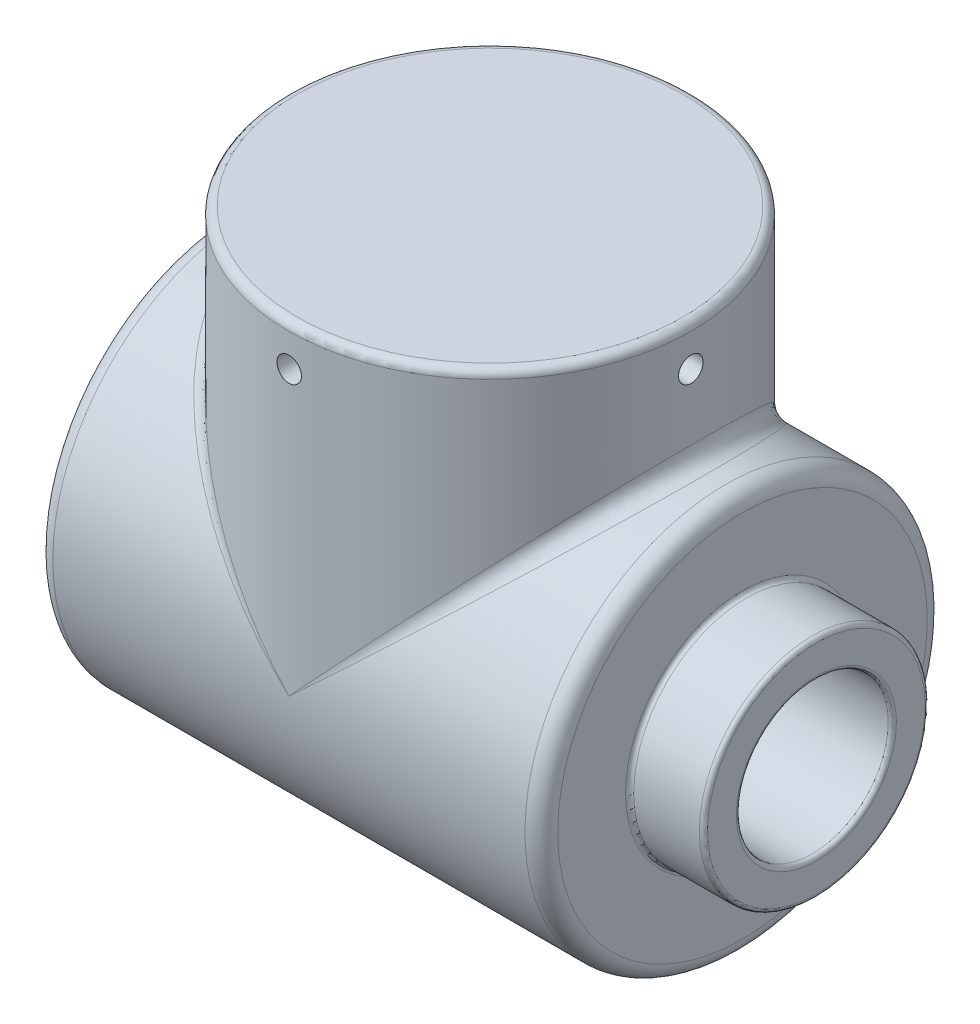
from build123d import *

# Parameters (mm, degrees)
SKETCH5_R                                  = 18.5
CUT_EXTRUDE2_DEPTH                         = 138
SKETCH11_R                                 = 49
BOSS_EXTRUDE3_DEPTH                        = 30
BOSS_EXTRUDE3_DIRECTION_2_REACH            = 137.371
BOSS_EXTRUDE3_DIRECTION_2_END_RADIUS       = 49
CUT_EXTRUDE3_REACH                         = 168.391
SKETCH12_R                                 = 2.3
CIRPATTERN1_COUNT                          = 6
SKETCH14_R                                 = 2.975
CUT_EXTRUDE4_DEPTH                         = 7.62
SKETCH15_R                                 = 2.99
CUT_EXTRUDE5_DEPTH                         = 4.7
MIRROR2_AT_THE_SECOND_PLANE_COPY_1_SKETC_R = 2.99
MIRROR2_AT_THE_SECOND_PLANE_COPY_1_DEPTH   = 4.7
FILLET3_R                                  = 2
FILLET4_R                                  = 4
FILLET5_R                                  = 4
FILLET6_R                                  = 4
FILLET7_R                                  = 1
FILLET8_R                                  = 0.5


with BuildPart() as part:
    # Sketch4 → Revolve2 (revolve)
    with BuildSketch(Plane.XY):
        Polygon((-61.5, 0), (79.5, 0), (79.5, 27.5), (61.5, 27.5), (61.5, 49), (-61.5, 49), align=None)
    revolve(axis=Axis((-61.5, 0, 0), (1, 0, 0)))

    # Sketch5 → Cut-Extrude2 (cut)
    with BuildSketch(Plane(origin=(79.5, 0, 0), x_dir=(0, 0, -1), z_dir=(1, 0, 0))):
        Circle(SKETCH5_R)
    extrude(amount=-CUT_EXTRUDE2_DEPTH, mode=Mode.SUBTRACT)

    # Sketch11 → Boss-Extrude3 (add)
    with BuildSketch(Plane(origin=(0, 49, 0), x_dir=(1, 0, 0), z_dir=(0, 1, 0))):
        Circle(SKETCH11_R)
    extrude(amount=BOSS_EXTRUDE3_DEPTH)

    # Boss-Extrude3 direction 2: up to this cylinder (the profile starts outside it)
    boss_extrude3_direction_2_end = Plane(origin=(0, 0, 0), z_dir=(-1, 0, 0)) * Cylinder(BOSS_EXTRUDE3_DIRECTION_2_END_RADIUS, 373.742, mode=Mode.PRIVATE)
    # Sketch11 → Boss-Extrude3 direction 2 (add, up to the surface)
    with BuildSketch(Plane(origin=(0, 49, 0), x_dir=(1, 0, 0), z_dir=(0, 1, 0)), mode=Mode.PRIVATE) as boss_extrude3_direction_2_sk1:
        Circle(SKETCH11_R)
    boss_extrude3_direction_2_tool1 = extrude(boss_extrude3_direction_2_sk1.sketch, amount=-BOSS_EXTRUDE3_DIRECTION_2_REACH, mode=Mode.PRIVATE) - boss_extrude3_direction_2_end
    add(boss_extrude3_direction_2_tool1.solids().sort_by_distance((0, 49, 0))[0])
    add(boss_extrude3_direction_2_tool1.solids().sort_by_distance((0, 49, 0))[1])

    # Sketch12 → Cut-Extrude3 (cut, up to next)
    with BuildSketch(Plane(origin=(-58.5, 0, 0), x_dir=(0, 0, -1), z_dir=(1, 0, 0)), mode=Mode.PRIVATE) as cut_extrude3_sk1:
        with Locations((0, 14)):
            Circle(SKETCH12_R)
    cut_extrude3_tool1 = extrude(cut_extrude3_sk1.sketch, amount=-CUT_EXTRUDE3_REACH, mode=Mode.PRIVATE) & part.part
    cut_extrude3 = cut_extrude3_tool1.solids().sort_by_distance((-58.5, 14, 0))[0]
    add(cut_extrude3, mode=Mode.SUBTRACT)

    # CirPattern1: Cut-Extrude3 ×6 about axis
    cirpattern1_axis = Axis((-58.5, 0, 0), (1, 0, 0))
    for i in range(1, CIRPATTERN1_COUNT):
        add(cut_extrude3.rotate(cirpattern1_axis, i * 360 / CIRPATTERN1_COUNT), mode=Mode.SUBTRACT)

    # Sketch14 → Cut-Extrude4 (cut)
    with BuildSketch(Plane.XY.offset(49)):
        with Locations((0, 69)):
            Circle(SKETCH14_R)
    cut_extrude4 = extrude(amount=-CUT_EXTRUDE4_DEPTH, mode=Mode.SUBTRACT)

    # Mirror1: Cut-Extrude4 across plane
    add(cut_extrude4.mirror(Plane.XY), mode=Mode.SUBTRACT)

    # Sketch15 → Cut-Extrude5 (cut)
    with BuildSketch(Plane(origin=(49, 0, 0), x_dir=(0, 0, -1), z_dir=(1, 0, 0))):
        with Locations((0, 69)):
            Circle(SKETCH15_R)
    cut_extrude5 = extrude(amount=-CUT_EXTRUDE5_DEPTH, mode=Mode.SUBTRACT)

    # Mirror2: Cut-Extrude5 across plane
    add(cut_extrude5.mirror(Plane(origin=(0, 0, 0), x_dir=(0, 0, 1), z_dir=(1, 0, 0))), mode=Mode.SUBTRACT)

    # Mirror2 at the second plane: Cut-Extrude5 across plane
    add(cut_extrude5.mirror(Plane(origin=(49, 0, 0), x_dir=(0, 0, 1), z_dir=(1, 0, 0))), mode=Mode.SUBTRACT)

    # Mirror2 at the second plane copy 1 sketc → Mirror2 at the second plane copy 1 (cut)
    with BuildSketch(Plane(origin=(147, 0, 0), x_dir=(0, 0, -1), z_dir=(1, 0, 0))):
        with Locations((0, 69)):
            Circle(MIRROR2_AT_THE_SECOND_PLANE_COPY_1_SKETC_R)
    extrude(amount=-MIRROR2_AT_THE_SECOND_PLANE_COPY_1_DEPTH, mode=Mode.SUBTRACT)

    # Fillet3
    fillet3_edges = [part.edges().sort_by_distance(p)[0] for p in [
        (-49, 79, 0),
    ]]
    fillet(fillet3_edges, radius=FILLET3_R)

    # Fillet4
    fillet4_edges = [part.edges().sort_by_distance(p)[0] for p in [
        (-31.656396463, 31.656396463, 37.401504822),
        (31.656396464, 31.656396464, 37.401504822),
    ]]
    fillet(fillet4_edges, radius=FILLET4_R)

    # Fillet5
    fillet5_edges = [part.edges().sort_by_distance(p)[0] for p in [
        (61.5, -49, 0),
    ]]
    fillet(fillet5_edges, radius=FILLET5_R)

    # Fillet6
    fillet6_edges = [part.edges().sort_by_distance(p)[0] for p in [
        (-61.5, -49, 0),
    ]]
    fillet(fillet6_edges, radius=FILLET6_R)

    # Fillet7
    fillet7_edges = [part.edges().sort_by_distance(p)[0] for p in [
        (79.5, 0, 18.5),
        (79.5, -27.5, 0),
        (61.5, -27.5, 0),
    ]]
    fillet(fillet7_edges, radius=FILLET7_R)

    # Fillet8
    fillet8_edges = [part.edges().sort_by_distance(p)[0] for p in [
        (-58.5, 0, 18.5),
    ]]
    fillet(fillet8_edges, radius=FILLET8_R)


solid = part.part
